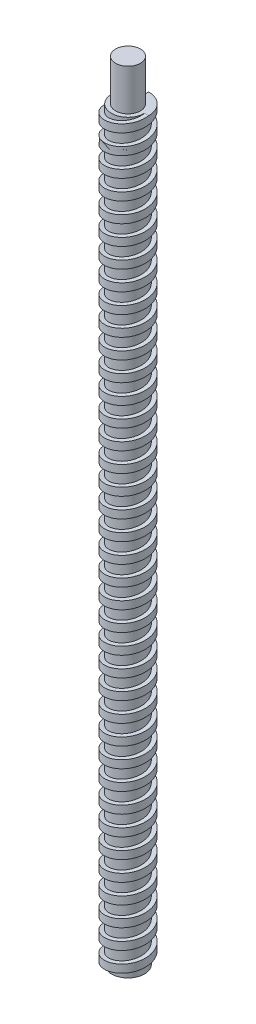
from build123d import *
from build123d.topology import SkipClean

# Parameters (mm, degrees)
SKETCH1_R           = 4
BOSS_EXTRUDE1_DEPTH = 190.5
SWEEP1_PITCH        = 4.7625
SKETCH10_R          = 5.381308001
SKETCH10_R_2        = 3
CUT_EXTRUDE3_DEPTH  = 10


with BuildPart() as part:
    # Sketch1 → Boss-Extrude1 (new body)
    with BuildSketch(Plane(origin=(0, 0, 0), x_dir=(1, 0, 0), z_dir=(0, 1, 0))):
        with Locations(Location((0, 0, 0), (0, 0, 270))):
            Circle(SKETCH1_R)
    extrude(amount=BOSS_EXTRUDE1_DEPTH)

    # Sweep1: arcs per turn and ends read off the stored shape
    # Sweep1: the profile of Sketch6 profile screwed along a right-hand helix through 37.75 turns, 12 arcs to a turn; built about Z, then put on its axis
    with SkipClean():  # the faces are left unmerged after this step: merging them gives an invalid solid
        sweep1_z = Axis((0, 0, 0), (0, 0, 1))
        sweep1_corners = [(3.9997, 0, 0), (5, 0, 0), (5, 0, 1.905), (3.9997, 0, 1.905)]
        with BuildLine(mode=Mode.PRIVATE) as sweep1_profile:
            Line(sweep1_corners[0], sweep1_corners[1])
            Line(sweep1_corners[1], sweep1_corners[2])
            Line(sweep1_corners[2], sweep1_corners[3])
            Line(sweep1_corners[3], sweep1_corners[0])
        sweep1_cap = Face(sweep1_profile.wire())
        sweep1_turn_angles = [0, 15, 30, 45, 60, 75, 90, 105, 120, 135, 150, 165, 180, 195, 210, 225, 240, 255, 270, 285, 300, 315, 330, 345, 360]
        sweep1_turn_weights = [1, 0.9659258262890683, 1, 0.9659258262890683, 1, 0.9659258262890683, 1, 0.9659258262890683, 1, 0.9659258262890683, 1, 0.9659258262890683, 1, 0.9659258262890683, 1, 0.9659258262890683, 1, 0.9659258262890683, 1, 0.9659258262890683, 1, 0.9659258262890683, 1, 0.9659258262890683, 1]
        sweep1_turn_rails = [Edge.make_bspline([Vector(p[0], p[1], 0).rotate(sweep1_z, sweep1_turn_angles[k]) / sweep1_turn_weights[k] + Vector(0, 0, p[2] + SWEEP1_PITCH * sweep1_turn_angles[k] / 360) for k in range(25)], [0, 0, 0, 1, 1, 2, 2, 3, 3, 4, 4, 5, 5, 6, 6, 7, 7, 8, 8, 9, 9, 10, 10, 11, 11, 12, 12, 12], 2, sweep1_turn_weights) for p in sweep1_corners]
        sweep1_turn_sides = [Face.make_surface_from_curves(sweep1_turn_rails[p[0]], sweep1_turn_rails[p[1]]) for p in [(0, 1), (1, 2), (2, 3), (3, 0)]]
        sweep1_last_angles = [13320, 13335, 13350, 13365, 13380, 13395, 13410, 13425, 13440, 13455, 13470, 13485, 13500, 13515, 13530, 13545, 13560, 13575, 13590]
        sweep1_last_weights = [1, 0.9659258262890683, 1, 0.9659258262890683, 1, 0.9659258262890683, 1, 0.9659258262890683, 1, 0.9659258262890683, 1, 0.9659258262890683, 1, 0.9659258262890683, 1, 0.9659258262890683, 1, 0.9659258262889286, 1]
        sweep1_last_rails = [Edge.make_bspline([Vector(p[0], p[1], 0).rotate(sweep1_z, sweep1_last_angles[k]) / sweep1_last_weights[k] + Vector(0, 0, p[2] + SWEEP1_PITCH * sweep1_last_angles[k] / 360) for k in range(19)], [0, 0, 0, 1, 1, 2, 2, 3, 3, 4, 4, 5, 5, 6, 6, 7, 7, 8, 8, 9, 9, 9], 2, sweep1_last_weights) for p in sweep1_corners]
        sweep1_last_sides = [Face.make_surface_from_curves(sweep1_last_rails[p[0]], sweep1_last_rails[p[1]]) for p in [(0, 1), (1, 2), (2, 3), (3, 0)]]
        sweep1 = Plane(origin=(0, 0, 0), x_dir=(-1, 0, 0), z_dir=(0, 1, 0)) * Solid(Shell([*[p.moved(Location((0, 0, SWEEP1_PITCH * i))) for i in range(37) for p in sweep1_turn_sides], *sweep1_last_sides, sweep1_cap, sweep1_cap.rotate(sweep1_z, 13590).moved(Location((0, 0, SWEEP1_PITCH * 13590 / 360)))]))
        add(sweep1)

    # Sketch10 → Cut-Extrude3 (cut, symmetric)
    with SkipClean():  # the faces are left unmerged after this step: merging them gives an invalid solid
        with BuildSketch(Plane(origin=(0, 190.5, 0), x_dir=(1, 0, 0), z_dir=(0, 1, 0))):
            Circle(SKETCH10_R)
            with Locations(Location((0, 0, 0), (0, 0, 270))):
                Circle(SKETCH10_R_2, mode=Mode.SUBTRACT)
        extrude(amount=CUT_EXTRUDE3_DEPTH, both=True, mode=Mode.SUBTRACT)


solid = part.part
